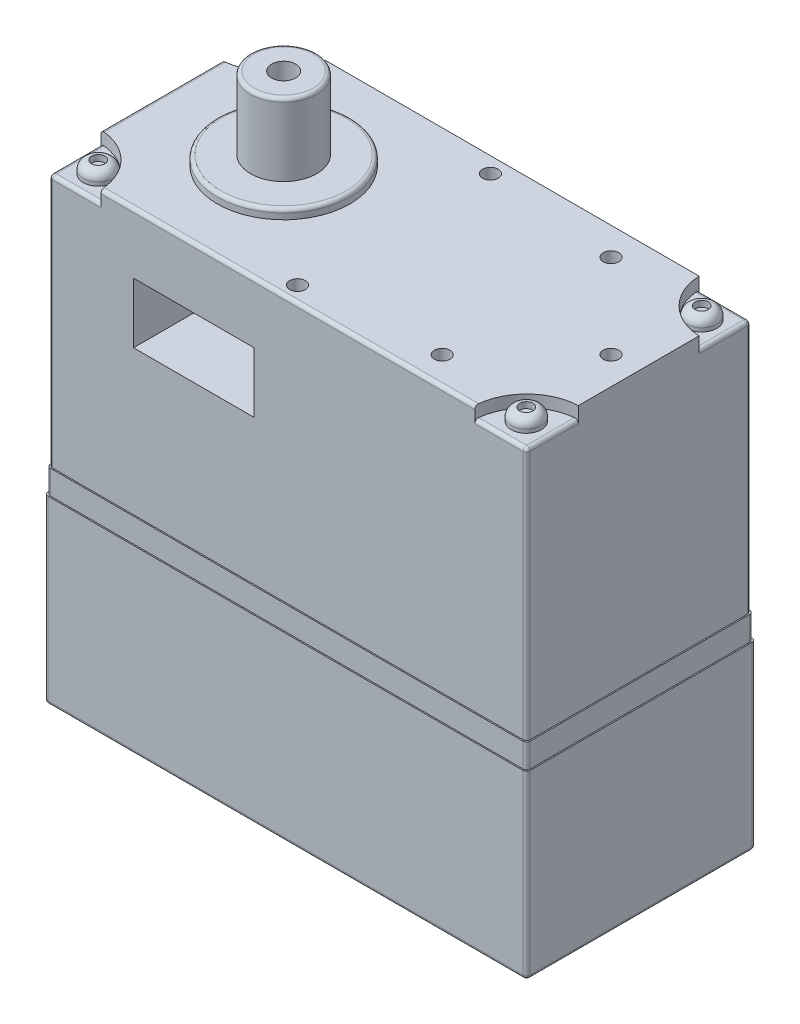
from build123d import *

# Parameters (mm, degrees)
SKETCH_1_W             = 40
SKETCH_1_H             = 39
EXTRUDE_1_DEPTH        = 19
CUT_EXTRUDE_1_DEPTH    = 1
SKETCH_4_R             = 1.25
EXTRUDE_2_DEPTH        = 1
FILLET_4_R             = 0.7
SKETCH_8_R             = 0.55
CUT_EXTRUDE_2_DEPTH    = 0.5
FILLET_4_OF_MIRROR_1_R = 0.7
SKETCH_9_R             = 0.65
CUT_EXTRUDE_3_DEPTH    = 3
SKETCH_10_R            = 0.65
CUT_EXTRUDE_4_DEPTH    = 3
SKETCH_11_R            = 5.5
EXTRUDE_3_DEPTH        = 0.8
FILLET_5_R             = 0.3
SKETCH_13_R            = 2.75
EXTRUDE_4_DEPTH        = 6
FILLET_6_R             = 0.3
SKETCH_14_R            = 1
CUT_EXTRUDE_5_DEPTH    = 5
CUT_EXTRUDE_START      = -5
SKETCH_15_R            = 0.65
CUT_EXTRUDE_6_DEPTH    = 5
EXTRUDE_START          = 0.8
SKETCH_18_R            = 5.5
EXTRUDE_5_DEPTH        = 0.8
FILLET_17_R            = 0.3
SKETCH_37_W            = 19
SKETCH_37_H            = 2
CUT_EXTRUDE_26_DEPTH   = 0.1
SKETCH_38_W            = 40
SKETCH_38_H            = 2
CUT_EXTRUDE_27_DEPTH   = 0.1
SKETCH_39_W            = 19
SKETCH_39_H            = 2
CUT_EXTRUDE_28_DEPTH   = 0.1
SKETCH_40_W            = 40
SKETCH_40_H            = 2
CUT_EXTRUDE_29_DEPTH   = 0.1
SKETCH_44_W            = 40
SKETCH_44_H            = 22
CUT_EXTRUDE_30_DEPTH   = 0.2
SKETCH_41_W            = 19
SKETCH_41_H            = 22
CUT_EXTRUDE_31_DEPTH   = 0.2
SKETCH_42_W            = 40
SKETCH_42_H            = 22
CUT_EXTRUDE_32_DEPTH   = 0.2
SKETCH_43_W            = 19
SKETCH_43_H            = 22
CUT_EXTRUDE_33_DEPTH   = 0.2
FILLET_18_R            = 0.3
FILLET_19_R            = 0.3
FILLET_20_R            = 0.3
FILLET_21_R            = 0.3
FILLET_22_R            = 0.3
FILLET_23_R            = 0.3
FILLET_24_R            = 0.3
FILLET_25_R            = 0.3
FILLET_26_R            = 0.3
FILLET_27_R            = 0.3
FILLET_28_R            = 0.3
FILLET_29_R            = 0.3
FILLET_30_R            = 0.3
FILLET_31_R            = 0.3
FILLET_32_R            = 0.3
FILLET_33_R            = 0.3
FILLET_34_R            = 0.3
FILLET_35_R            = 0.3
FILLET_36_R            = 0.3
SKETCH_45_W            = 10
SKETCH_45_H            = 5
CUT_EXTRUDE_34_DEPTH   = 5
SKETCH_46_W            = 10
SKETCH_46_H            = 5
CUT_EXTRUDE_35_DEPTH   = 5
SKETCH_47_R            = 3
EXTRUDE_6_DEPTH        = 4


# Read off the part's stored shape, not the designer's step: 镜向5
# Some blends are built 0.0001 mm under size
with BuildPart() as part:
    # 草图1 → 凸台-拉伸1 (new body)
    with BuildSketch(Plane.XY):
        with Locations((-20, 19.5)):
            Rectangle(SKETCH_1_W, SKETCH_1_H)
    extrude(amount=EXTRUDE_1_DEPTH)

    # 草图3 → 切除-拉伸1 (cut)
    with BuildSketch(Plane(origin=(0, 39, 0), x_dir=(1, 0, 0), z_dir=(0, 1, 0))):
        with BuildLine():
            Line((-40, 0), (-40, -4.5))
            ThreePointArc((-40, -4.5), (-36.818019485, -3.181980515), (-35.5, 0))
            Line((-35.5, 0), (-40, 0))
        make_face()
        with BuildLine():
            ThreePointArc((-35.5, -19), (-36.818019485, -15.818019485), (-40, -14.5))
            Line((-40, -14.5), (-40, -19))
            Line((-40, -19), (-35.5, -19))
        make_face()
        with BuildLine():
            ThreePointArc((-4.5, 0), (-3.181980515, -3.181980515), (0, -4.5))
            Line((0, -4.5), (0, 0))
            Line((0, 0), (-4.5, 0))
        make_face()
        with BuildLine():
            Line((0, -19), (0, -14.5))
            ThreePointArc((0, -14.5), (-3.181980515, -15.818019485), (-4.5, -19))
            Line((-4.5, -19), (0, -19))
        make_face()
    extrude(amount=-CUT_EXTRUDE_1_DEPTH, mode=Mode.SUBTRACT)

    # 草图4 → 凸台-拉伸2 (add)
    with BuildSketch(Plane(origin=(0, 38, 0), x_dir=(1, 0, 0), z_dir=(0, 1, 0))):
        with Locations(Location((-37.75, -16.774202652, 0), (0, 0, 180))):
            Circle(SKETCH_4_R)
    extrude_2 = extrude(amount=EXTRUDE_2_DEPTH)

    # 圆角4
    fillet_4_edges = [part.edges().sort_by_distance(p)[0] for p in [
        (-36.5, 39, 16.774202652),
    ]]
    fillet(fillet_4_edges, radius=FILLET_4_R - 0.0001)  # a hair under: the kernel refuses the full size

    # 草图8 → 切除-拉伸2 (cut)
    with BuildSketch(Plane(origin=(0, 39, 0), x_dir=(1, 0, 0), z_dir=(0, 1, 0))):
        with Locations(Location((-37.75, -16.774202652, 0), (0, 0, 180))):
            Circle(SKETCH_8_R)
    cut_extrude_2 = extrude(amount=-CUT_EXTRUDE_2_DEPTH, mode=Mode.SUBTRACT)

    # 镜向1: 凸台-拉伸2, 切除-拉伸2 across plane
    add(extrude_2.mirror(Plane(origin=(-20, 0, 0), x_dir=(0, 0, 1), z_dir=(1, 0, 0))))
    add(cut_extrude_2.mirror(Plane(origin=(-20, 0, 0), x_dir=(0, 0, 1), z_dir=(1, 0, 0))), mode=Mode.SUBTRACT)

    # 圆角4 of 镜向1
    fillet_4_of_mirror_1_edges = [part.edges().sort_by_distance(p)[0] for p in [
        (-3.5, 39, 16.774202652),
    ]]
    fillet(fillet_4_of_mirror_1_edges, radius=FILLET_4_OF_MIRROR_1_R - 0.0001)  # a hair under: the kernel refuses the full size

    # 镜向5 outline → 镜向5 (revolve)
    with BuildSketch(Plane(origin=(-2.25, 0, 2.225797348), x_dir=(1, 0, 0), z_dir=(0, 0, 1))):
        with BuildLine():
            Line((1.25, 38), (1.25, 38.3))
            ThreePointArc((1.25, 38.3), (1.044974747, 38.794974747), (0.55, 39))
            Line((0.55, 39), (0.55, 38.5))
            Line((0.55, 38.5), (0, 38.5))
            Line((0, 38.5), (0, 38))
            Line((0, 38), (1.25, 38))
        make_face()
    revolve(axis=Axis((-2.25, 0, 2.225797348), (0, 1, 0)))

    # Mirror 5 2 outline → Mirror 5 2 (revolve)
    with BuildSketch(Plane(origin=(-37.75, 0, 2.225797348), x_dir=(1, 0, 0), z_dir=(0, 0, 1))):
        with BuildLine():
            Line((1.25, 38), (1.25, 38.3))
            ThreePointArc((1.25, 38.3), (1.044974747, 38.794974747), (0.55, 39))
            Line((0.55, 39), (0.55, 38.5))
            Line((0.55, 38.5), (0, 38.5))
            Line((0, 38.5), (0, 38))
            Line((0, 38), (1.25, 38))
        make_face()
    revolve(axis=Axis((-37.75, 0, 2.225797348), (0, 1, 0)))

    # 草图9 → 切除-拉伸3 (cut)
    with BuildSketch(Plane(origin=(0, 39, 0), x_dir=(1, 0, 0), z_dir=(0, 1, 0))):
        with Locations(Location((-2.5, -9.5, 0), (0, 0, 180))):
            Circle(SKETCH_9_R)
    extrude(amount=-CUT_EXTRUDE_3_DEPTH, mode=Mode.SUBTRACT)

    # 草图10 → 切除-拉伸4 (cut)
    with BuildSketch(Plane(origin=(0, 39, 0), x_dir=(1, 0, 0), z_dir=(0, 1, 0))):
        with BuildLine():
            ThreePointArc((-19.85, -17.5), (-20.040380592, -17.040380592), (-20.5, -16.85))
            Line((-20.5, -16.85), (-20.5, -17.5))
            Line((-20.5, -17.5), (-19.85, -17.5))
        make_face()
        with BuildLine():
            Line((-20.5, -17.5), (-20.5, -16.85))
            ThreePointArc((-20.5, -16.85), (-20.959619408, -17.959619408), (-19.85, -17.5))
            Line((-19.85, -17.5), (-20.5, -17.5))
        make_face()
        with BuildLine():
            ThreePointArc((-19.85, -17.5), (-20.040380592, -17.040380592), (-20.5, -16.85))
            Line((-20.5, -16.85), (-20.5, -17.5))
            Line((-20.5, -17.5), (-19.85, -17.5))
        make_face()
        with BuildLine():
            Line((-20.5, -17.5), (-20.5, -16.85))
            ThreePointArc((-20.5, -16.85), (-20.959619408, -17.959619408), (-19.85, -17.5))
            Line((-19.85, -17.5), (-20.5, -17.5))
        make_face()
        with Locations(Location((-20.5, -1.5, 0), (0, 0, 180))):
            Circle(SKETCH_10_R)
        with Locations(Location((-9.5, -2.5, 0), (0, 0, 180))):
            Circle(SKETCH_10_R)
        with Locations(Location((-9.5, -16.5, 0), (0, 0, 180))):
            Circle(SKETCH_10_R)
    extrude(amount=-CUT_EXTRUDE_4_DEPTH, mode=Mode.SUBTRACT)

    # 草图11 → 凸台-拉伸3 (add)
    with BuildSketch(Plane(origin=(0, 39, 0), x_dir=(1, 0, 0), z_dir=(0, 1, 0))):
        with Locations((-29.65, -9.5)):
            Circle(SKETCH_11_R)
    extrude(amount=EXTRUDE_3_DEPTH)

    # 圆角5
    fillet_5_edges = [part.edges().sort_by_distance(p)[0] for p in [
        (-35.15, 39.8, 9.5),
    ]]
    fillet(fillet_5_edges, radius=FILLET_5_R)

    # 草图13 → 凸台-拉伸4 (add)
    with BuildSketch(Plane(origin=(0, 39.8, 0), x_dir=(1, 0, 0), z_dir=(0, 1, 0))):
        with Locations(Location((-29.65, -9.5, 0), (0, 0, 180))):
            Circle(SKETCH_13_R)
    extrude(amount=EXTRUDE_4_DEPTH)

    # 圆角6
    fillet_6_edges = [part.edges().sort_by_distance(p)[0] for p in [
        (-26.9, 45.8, 9.5),
    ]]
    fillet(fillet_6_edges, radius=FILLET_6_R)

    # 草图14 → 切除-拉伸5 (cut)
    with BuildSketch(Plane(origin=(0, 45.8, 0), x_dir=(1, 0, 0), z_dir=(0, 1, 0))):
        with Locations(Location((-29.65, -9.5, 0), (0, 0, 180))):
            Circle(SKETCH_14_R)
    extrude(amount=-CUT_EXTRUDE_5_DEPTH, mode=Mode.SUBTRACT)

    # 草图15 → 切除-拉伸6 (cut)
    with BuildSketch(Plane.XZ.offset(CUT_EXTRUDE_START)):
        with Locations(Location((-20.5, 1.5, 0), (0, 0, 180))):
            Circle(SKETCH_15_R)
        with Locations(Location((-9.5, 16.5, 0), (0, 0, 180))):
            Circle(SKETCH_15_R)
        with Locations(Location((-2.5, 9.5, 0), (0, 0, 180))):
            Circle(SKETCH_15_R)
        with Locations(Location((-20.5, 17.5, 0), (0, 0, 180))):
            Circle(SKETCH_15_R)
        with Locations(Location((-9.5, 2.5, 0), (0, 0, 180))):
            Circle(SKETCH_15_R)
    extrude(amount=CUT_EXTRUDE_6_DEPTH, mode=Mode.SUBTRACT)

    # 草图18 → 凸台-拉伸5 (add)
    with BuildSketch(Plane.XZ.offset(EXTRUDE_START)):
        with Locations((-29.65, 9.5)):
            Circle(SKETCH_18_R)
    extrude(amount=-EXTRUDE_5_DEPTH)

    # 圆角17
    fillet_17_edges = [part.edges().sort_by_distance(p)[0] for p in [
        (-35.15, -0.8, 9.5),
    ]]
    fillet(fillet_17_edges, radius=FILLET_17_R)

    # 草图37 → 切除-拉伸26 (cut)
    with BuildSketch(Plane.ZY.offset(40)):
        with Locations((9.5, 16)):
            Rectangle(SKETCH_37_W, SKETCH_37_H)
    extrude(amount=-CUT_EXTRUDE_26_DEPTH, mode=Mode.SUBTRACT)

    # 草图38 → 切除-拉伸27 (cut)
    with BuildSketch(Plane(origin=(0, 0, 0), x_dir=(-1, 0, 0), z_dir=(0, 0, -1))):
        with Locations((20, 16)):
            Rectangle(SKETCH_38_W, SKETCH_38_H)
    extrude(amount=-CUT_EXTRUDE_27_DEPTH, mode=Mode.SUBTRACT)

    # 草图39 → 切除-拉伸28 (cut)
    with BuildSketch(Plane(origin=(0, 0, 0), x_dir=(0, 0, -1), z_dir=(1, 0, 0))):
        with Locations((-9.5, 16)):
            Rectangle(SKETCH_39_W, SKETCH_39_H)
    extrude(amount=-CUT_EXTRUDE_28_DEPTH, mode=Mode.SUBTRACT)

    # 草图40 → 切除-拉伸29 (cut)
    with BuildSketch(Plane.XY.offset(19)):
        with Locations((-20, 16)):
            Rectangle(SKETCH_40_W, SKETCH_40_H)
    extrude(amount=-CUT_EXTRUDE_29_DEPTH, mode=Mode.SUBTRACT)

    # 草图44 → 切除-拉伸30 (cut)
    with BuildSketch(Plane.XY.offset(19)):
        with Locations((-20, 28)):
            Rectangle(SKETCH_44_W, SKETCH_44_H)
    extrude(amount=-CUT_EXTRUDE_30_DEPTH, mode=Mode.SUBTRACT)

    # 草图41 → 切除-拉伸31 (cut)
    with BuildSketch(Plane.ZY.offset(40)):
        with Locations((9.5, 28)):
            Rectangle(SKETCH_41_W, SKETCH_41_H)
    extrude(amount=-CUT_EXTRUDE_31_DEPTH, mode=Mode.SUBTRACT)

    # 草图42 → 切除-拉伸32 (cut)
    with BuildSketch(Plane(origin=(0, 0, 0), x_dir=(-1, 0, 0), z_dir=(0, 0, -1))):
        with Locations((20, 28)):
            Rectangle(SKETCH_42_W, SKETCH_42_H)
    extrude(amount=-CUT_EXTRUDE_32_DEPTH, mode=Mode.SUBTRACT)

    # 草图43 → 切除-拉伸33 (cut)
    with BuildSketch(Plane(origin=(0, 0, 0), x_dir=(0, 0, -1), z_dir=(1, 0, 0))):
        with Locations((-9.5, 28)):
            Rectangle(SKETCH_43_W, SKETCH_43_H)
    extrude(amount=-CUT_EXTRUDE_33_DEPTH, mode=Mode.SUBTRACT)

    # 圆角18
    fillet_18_edges = [part.edges().sort_by_distance(p)[0] for p in [
        (-39.8, 39, 9.5),
    ]]
    fillet(fillet_18_edges, radius=FILLET_18_R)

    # 圆角19
    fillet_19_edges = [part.edges().sort_by_distance(p)[0] for p in [
        (-20, 0, 19),
        (-20, 0, 0),
        (0, 0, 9.5),
        (-40, 0, 9.5),
    ]]
    fillet(fillet_19_edges, radius=FILLET_19_R)

    # 圆角20
    fillet_20_edges = [part.edges().sort_by_distance(p)[0] for p in [
        (-0.1, 16, 18.9),
    ]]
    fillet(fillet_20_edges, radius=FILLET_20_R)

    # 圆角21
    # the kernel refuses this fillet: 0.3 mm, written as the material it takes off along each edge
    with BuildSketch(Plane(origin=(-0.3, 0.3, 18.7), x_dir=(0, 0, 1), z_dir=(1, 0, 0))) as fillet_21_piece_1_section:
        Polygon((0, 0), (FILLET_21_R, 0), (FILLET_21_R, FILLET_21_R), (0, FILLET_21_R), align=None)
    fillet_21_piece_1 = extrude(amount=FILLET_21_R, mode=Mode.PRIVATE)
    fillet_21_piece_1 = fillet_21_piece_1 - Plane(origin=(-0.3, 0.3, 18.7), x_dir=(0, 0.7071067811865475, -0.7071067811865475), z_dir=(1, 0, 0)) * Sphere(FILLET_21_R, mode=Mode.PRIVATE)
    add(fillet_21_piece_1, mode=Mode.SUBTRACT)
    with BuildSketch(Plane(origin=(0, 15.75, 19), x_dir=(0, 0, -1), z_dir=(0, -1, 0))) as fillet_21_piece_2:
        with BuildLine():
            CenterArc((FILLET_21_R, -FILLET_21_R), FILLET_21_R, 90, 90)
            Line((0, -FILLET_21_R), (0, 0))
            Line((0, 0), (FILLET_21_R, 0))
        make_face()
    extrude(amount=15.45, mode=Mode.SUBTRACT)

    # 圆角22
    fillet_22_edges = [part.edges().sort_by_distance(p)[0] for p in [
        (-0.2, 27.5, 18.8),
    ]]
    fillet(fillet_22_edges, radius=FILLET_22_R)

    # 圆角23
    # the kernel refuses this fillet: 0.3 mm, written as the material it takes off along each edge
    with BuildSketch(Plane(origin=(-0.3, 0.3, 0.3), x_dir=(0, 0, -1), z_dir=(1, 0, 0))) as fillet_23_piece_1_section:
        Polygon((0, 0), (FILLET_23_R, 0), (FILLET_23_R, -FILLET_23_R), (0, -FILLET_23_R), align=None)
    fillet_23_piece_1 = extrude(amount=FILLET_23_R, mode=Mode.PRIVATE)
    fillet_23_piece_1 = fillet_23_piece_1 - Plane(origin=(-0.3, 0.3, 0.3), x_dir=(0, 0.7071067811865475, 0.7071067811865475), z_dir=(1, 0, 0)) * Sphere(FILLET_23_R, mode=Mode.PRIVATE)
    add(fillet_23_piece_1, mode=Mode.SUBTRACT)
    with BuildSketch(Plane(origin=(0, 15.75, 0), x_dir=(0, 0, 1), z_dir=(0, -1, 0))) as fillet_23_piece_2:
        with BuildLine():
            CenterArc((FILLET_23_R, FILLET_23_R), FILLET_23_R, 180, 90)
            Line((0, FILLET_23_R), (0, 0))
            Line((0, 0), (FILLET_23_R, 0))
        make_face()
    extrude(amount=15.45, mode=Mode.SUBTRACT)

    # 圆角24
    fillet_24_edges = [part.edges().sort_by_distance(p)[0] for p in [
        (-0.1, 16, 0.1),
    ]]
    fillet(fillet_24_edges, radius=FILLET_24_R)

    # 圆角25
    fillet_25_edges = [part.edges().sort_by_distance(p)[0] for p in [
        (-0.2, 27.5, 0.2),
    ]]
    fillet(fillet_25_edges, radius=FILLET_25_R)

    # 圆角26
    fillet_26_edges = [part.edges().sort_by_distance(p)[0] for p in [
        (-39.8, 27.5, 18.8),
    ]]
    fillet(fillet_26_edges, radius=FILLET_26_R)

    # 圆角27
    fillet_27_edges = [part.edges().sort_by_distance(p)[0] for p in [
        (-39.9, 16, 0.1),
    ]]
    fillet(fillet_27_edges, radius=FILLET_27_R)

    # 圆角28
    # the kernel refuses this fillet: 0.3 mm, written as the material it takes off along each edge
    with BuildSketch(Plane(origin=(-39.7, 0.3, 0.3), x_dir=(-1, 0, 0), z_dir=(0, 0, -1))) as fillet_28_piece_1_section:
        Polygon((0, 0), (FILLET_28_R, 0), (FILLET_28_R, -FILLET_28_R), (0, -FILLET_28_R), align=None)
    fillet_28_piece_1 = extrude(amount=FILLET_28_R, mode=Mode.PRIVATE)
    fillet_28_piece_1 = fillet_28_piece_1 - Plane(origin=(-39.7, 0.3, 0.3), x_dir=(0.7071067811865475, 0.7071067811865476, 0), z_dir=(0, 0, -1)) * Sphere(FILLET_28_R, mode=Mode.PRIVATE)
    add(fillet_28_piece_1, mode=Mode.SUBTRACT)
    with BuildSketch(Plane(origin=(-40, 0.3, 0), x_dir=(1, 0, 0), z_dir=(0, 1, 0))) as fillet_28_piece_2:
        with BuildLine():
            CenterArc((FILLET_28_R, -FILLET_28_R), FILLET_28_R, 90, 90)
            Line((0, -FILLET_28_R), (0, 0))
            Line((0, 0), (FILLET_28_R, 0))
        make_face()
    extrude(amount=15.45, mode=Mode.SUBTRACT)

    # 圆角29
    fillet_29_edges = [part.edges().sort_by_distance(p)[0] for p in [
        (-39.8, 27.5, 0.2),
    ]]
    fillet(fillet_29_edges, radius=FILLET_29_R)

    # 圆角30
    fillet_30_edges = [part.edges().sort_by_distance(p)[0] for p in [
        (-39.9, 16, 18.9),
    ]]
    fillet(fillet_30_edges, radius=FILLET_30_R)

    # 圆角31
    # the kernel refuses this fillet: 0.3 mm, written as the material it takes off along each edge
    with BuildSketch(Plane(origin=(-39.7, 0.3, 18.7), x_dir=(0, 0, 1), z_dir=(-1, 0, 0))) as fillet_31_piece_1_section:
        Polygon((0, 0), (FILLET_31_R, 0), (FILLET_31_R, -FILLET_31_R), (0, -FILLET_31_R), align=None)
    fillet_31_piece_1 = extrude(amount=FILLET_31_R, mode=Mode.PRIVATE)
    fillet_31_piece_1 = fillet_31_piece_1 - Plane(origin=(-39.7, 0.3, 18.7), x_dir=(0, 0.7071067811865475, -0.7071067811865475), z_dir=(-1, 0, 0)) * Sphere(FILLET_31_R, mode=Mode.PRIVATE)
    add(fillet_31_piece_1, mode=Mode.SUBTRACT)
    with BuildSketch(Plane(origin=(-40, 0.3, 19), x_dir=(0, 0, -1), z_dir=(0, 1, 0))) as fillet_31_piece_2:
        with BuildLine():
            CenterArc((FILLET_31_R, -FILLET_31_R), FILLET_31_R, 90, 90)
            Line((0, -FILLET_31_R), (0, 0))
            Line((0, 0), (FILLET_31_R, 0))
        make_face()
    extrude(amount=15.45, mode=Mode.SUBTRACT)

    # 圆角32
    fillet_32_edges = [part.edges().sort_by_distance(p)[0] for p in [
        (-20, 39, 18.8),
    ]]
    fillet(fillet_32_edges, radius=FILLET_32_R)

    # 圆角33
    fillet_33_edges = [part.edges().sort_by_distance(p)[0] for p in [
        (-0.2, 38, 16.502223321),
        (-2.497776679, 38, 18.8),
        (-0.287867966, 38, 18.712132034),
    ]]
    fillet(fillet_33_edges, radius=FILLET_33_R)

    # 圆角34
    fillet_34_edges = [part.edges().sort_by_distance(p)[0] for p in [
        (-37.502223321, 38, 18.8),
        (-39.8, 38, 16.502223321),
        (-39.712132034, 38, 18.712132034),
    ]]
    fillet(fillet_34_edges, radius=FILLET_34_R)

    # 圆角35
    fillet_35_edges = [part.edges().sort_by_distance(p)[0] for p in [
        (-39.8, 38, 2.497776679),
        (-37.502223321, 38, 0.2),
        (-39.712132034, 38, 0.287867966),
    ]]
    fillet(fillet_35_edges, radius=FILLET_35_R)

    # 圆角36
    fillet_36_edges = [part.edges().sort_by_distance(p)[0] for p in [
        (-2.497776679, 38, 0.2),
        (-0.2, 38, 2.497776679),
        (-0.287867966, 38, 0.287867966),
    ]]
    fillet(fillet_36_edges, radius=FILLET_36_R)

    # 草图45 → 切除-拉伸34 (cut)
    with BuildSketch(Plane.XY.offset(18.8)):
        with Locations((-27.8, 31.5)):
            Rectangle(SKETCH_45_W, SKETCH_45_H)
    extrude(amount=-CUT_EXTRUDE_34_DEPTH, mode=Mode.SUBTRACT)

    # 草图46 → 切除-拉伸35 (cut)
    with BuildSketch(Plane(origin=(0, 0, 0.2), x_dir=(-1, 0, 0), z_dir=(0, 0, -1))):
        with Locations((27.8, 31.5)):
            Rectangle(SKETCH_46_W, SKETCH_46_H)
    extrude(amount=-CUT_EXTRUDE_35_DEPTH, mode=Mode.SUBTRACT)

    # 草图47 → 凸台-拉伸6 (add)
    with BuildSketch(Plane.XZ.offset(0.8)):
        with Locations((-29.65, 9.5)):
            Circle(SKETCH_47_R)
    extrude(amount=EXTRUDE_6_DEPTH)


solid = part.part
